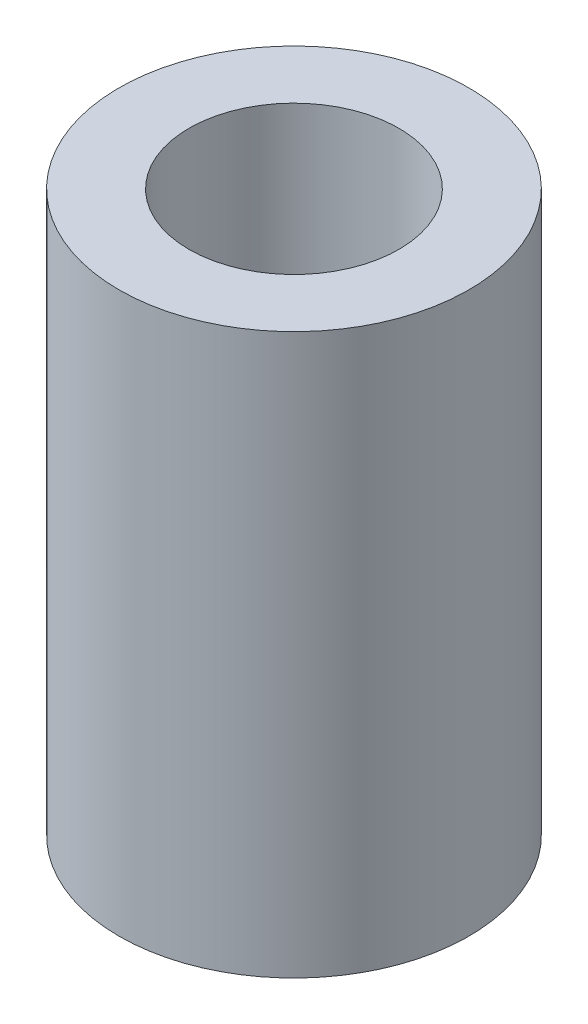
from build123d import *

# Parameters (mm, degrees)
SKETCH1_R           = 2.5
SKETCH1_R_2         = 1.5
BOSS_EXTRUDE1_DEPTH = 8


with BuildPart() as part:
    # Sketch1 → Boss-Extrude1 (new body)
    with BuildSketch(Plane(origin=(0, 0, 0), x_dir=(1, 0, 0), z_dir=(0, 1, 0))):
        Circle(SKETCH1_R)
        Circle(SKETCH1_R_2, mode=Mode.SUBTRACT)
    extrude(amount=BOSS_EXTRUDE1_DEPTH)


solid = part.part
